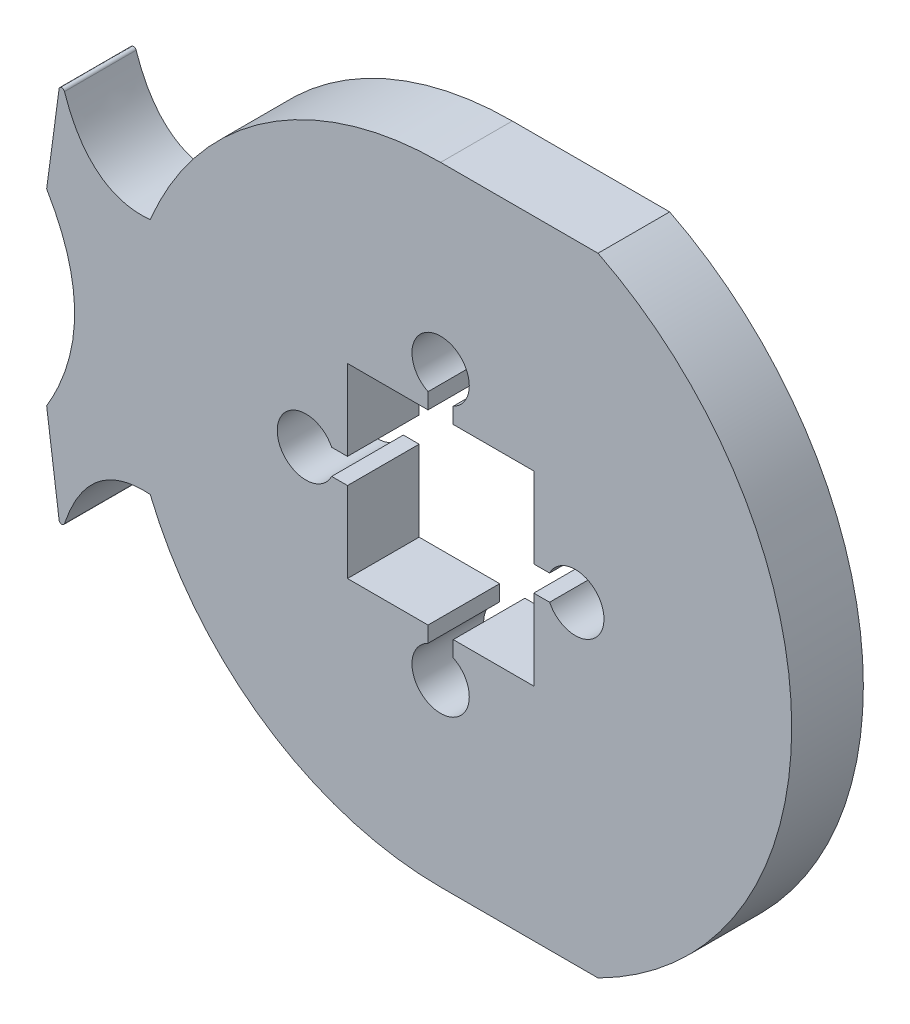
from build123d import *

# Parameters (mm, degrees)
BOSS_EXTRUDE1_DEPTH = 6.35


with BuildPart() as part:
    # Sketch1 → Boss-Extrude1 (new body)
    with BuildSketch(Plane.XY):
        with BuildLine():
            Line((13.949202701, 27.813), (0, 27.813))
            ThreePointArc((0, 27.813), (-15.495722247, 23.096440441), (-25.735880772, 10.546440626))
            add(Edge.make_bspline(
                [(-33.335263894, 16.577622785), (-31.897734861, 12.244147731), (-29.218007482, 10.187725291), (-25.735880772, 10.546440626)],
                knots=[0.081540764, 0.081540764, 0.081540764, 0.081540764, 1, 1, 1, 1], degree=3))
            ThreePointArc((-33.335263894, 16.577622785), (-33.559636624, 16.751099462), (-33.804841532, 16.608579877))
            Line((-33.804841532, 16.608579877), (-34.917209585, 8.319768485))
            add(Edge.make_bspline(
                [(-34.917209585, 8.319768485), (-29.956448806, 0), (-34.917209585, -8.319768485)],
                knots=[0, 0, 0, 1, 1, 1], degree=2))
            Line((-34.917209585, -8.319768485), (-33.804841532, -16.608579877))
            ThreePointArc((-33.804841532, -16.608579877), (-33.559636624, -16.751099462), (-33.335263894, -16.577622785))
            add(Edge.make_bspline(
                [(-33.335263894, -16.577622785), (-31.897734861, -12.244147731), (-29.230448697, -10.289617961), (-25.735880772, -10.546440626)],
                knots=[0.081540764, 0.081540764, 0.081540764, 0.081540764, 1, 1, 1, 1], degree=3))
            ThreePointArc((-25.735880772, -10.546440626), (-15.495722247, -23.096440441), (0, -27.813))
            Line((0, -27.813), (13.949202701, -27.813))
            ThreePointArc((13.949202701, -27.813), (31.115, 0), (13.949202701, 27.813))
        make_face()
        with BuildLine():
            Line((-8.255, 1.1176), (-8.255, 8.255))
            Line((-8.255, 8.255), (-1.1176, 8.255))
            Line((-1.1176, 8.255), (-1.1176, 9.657085657))
            ThreePointArc((-1.1176, 9.657085657), (-1.344041666, 14.093261469), (2.54, 11.938))
            ThreePointArc((2.54, 11.938), (2.155261469, 10.593958334), (1.1176, 9.657085657))
            Line((1.1176, 9.657085657), (1.1176, 8.255))
            Line((1.1176, 8.255), (8.255, 8.255))
            Line((8.255, 8.255), (8.255, 1.1176))
            Line((8.255, 1.1176), (9.657085657, 1.1176))
            ThreePointArc((9.657085657, 1.1176), (12.511619024, 2.474380976), (14.478, 0))
            ThreePointArc((14.478, 0), (12.511619024, -2.474380976), (9.657085657, -1.1176))
            Line((9.657085657, -1.1176), (8.255, -1.1176))
            Line((8.255, -1.1176), (8.255, -8.255))
            Line((8.255, -8.255), (1.1176, -8.255))
            Line((1.1176, -8.255), (1.1176, -9.657085657))
            ThreePointArc((1.1176, -9.657085657), (2.155261469, -10.593958334), (2.54, -11.938))
            ThreePointArc((2.54, -11.938), (-1.344041666, -14.093261469), (-1.1176, -9.657085657))
            Line((-1.1176, -9.657085657), (-1.1176, -8.255))
            Line((-1.1176, -8.255), (-8.255, -8.255))
            Line((-8.255, -8.255), (-8.255, -1.1176))
            Line((-8.255, -1.1176), (-9.657085657, -1.1176))
            ThreePointArc((-9.657085657, -1.1176), (-14.478, 0), (-9.657085657, 1.1176))
            Line((-9.657085657, 1.1176), (-8.255, 1.1176))
        make_face(mode=Mode.SUBTRACT)
    extrude(amount=BOSS_EXTRUDE1_DEPTH)


solid = part.part
